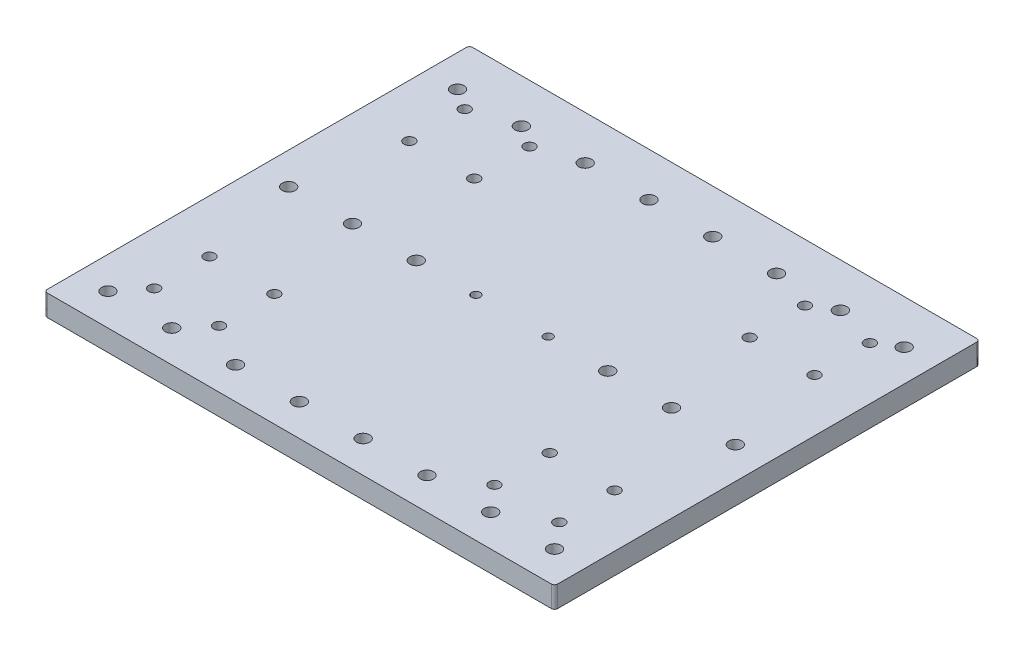
from build123d import *

# Parameters (mm, degrees)
SKETCH1_W           = 240
SKETCH1_H           = 200
BOSS_EXTRUDE1_DEPTH = 5
SKETCH2_R           = 2.55
CUT_EXTRUDE1_DEPTH  = 157.524758425
SKETCH3_R           = 2.05
CUT_EXTRUDE2_DEPTH  = 157.524758425
SKETCH4_R           = 3.05
CUT_EXTRUDE3_DEPTH  = 157.524758425
FILLET1_R           = 1.5


with BuildPart() as part:
    # Sketch1 → Boss-Extrude1 (new, symmetric)
    with BuildSketch(Plane(origin=(0, 0, 0), x_dir=(1, 0, 0), z_dir=(0, 1, 0))):
        Rectangle(SKETCH1_W, SKETCH1_H)
    extrude(amount=BOSS_EXTRUDE1_DEPTH, both=True)

    # Sketch2 → Cut-Extrude1 (cut, through all)
    with BuildSketch(Plane(origin=(0, 5, 0), x_dir=(1, 0, 0), z_dir=(0, 1, 0))):
        with Locations((-95.25, 73)):
            Circle(SKETCH2_R)
        with Locations((-95.25, 47)):
            Circle(SKETCH2_R)
        with Locations((-64.75, 73)):
            Circle(SKETCH2_R)
        with Locations((-64.75, 47)):
            Circle(SKETCH2_R)
        with Locations((-95.25, -47)):
            Circle(SKETCH2_R)
        with Locations((-95.25, -73)):
            Circle(SKETCH2_R)
        with Locations((-64.75, -73)):
            Circle(SKETCH2_R)
        with Locations((-64.75, -47)):
            Circle(SKETCH2_R)
        with Locations((95.25, -47)):
            Circle(SKETCH2_R)
        with Locations((64.75, -47)):
            Circle(SKETCH2_R)
        with Locations((64.75, -73)):
            Circle(SKETCH2_R)
        with Locations((95.25, -73)):
            Circle(SKETCH2_R)
        with Locations((64.75, 73)):
            Circle(SKETCH2_R)
        with Locations((64.75, 47)):
            Circle(SKETCH2_R)
        with Locations((95.25, 73)):
            Circle(SKETCH2_R)
        with Locations((95.25, 47)):
            Circle(SKETCH2_R)
    extrude(amount=-CUT_EXTRUDE1_DEPTH, mode=Mode.SUBTRACT)

    # Sketch3 → Cut-Extrude2 (cut, through all)
    with BuildSketch(Plane(origin=(0, 5, 0), x_dir=(1, 0, 0), z_dir=(0, 1, 0))):
        with Locations((-17, 0)):
            Circle(SKETCH3_R)
        with Locations((17, 0)):
            Circle(SKETCH3_R)
    extrude(amount=-CUT_EXTRUDE2_DEPTH, mode=Mode.SUBTRACT)

    # Sketch4 → Cut-Extrude3 (cut, through all)
    with BuildSketch(Plane(origin=(0, 5, 0), x_dir=(1, 0, 0), z_dir=(0, 1, 0))):
        with Locations((-105, 79.393522691)):
            Circle(SKETCH4_R)
        with Locations((-75, 79.393522691)):
            Circle(SKETCH4_R)
        with Locations((-45, 79.393522691)):
            Circle(SKETCH4_R)
        with Locations((-15, 79.393522691)):
            Circle(SKETCH4_R)
        with Locations((15, 79.393522691)):
            Circle(SKETCH4_R)
        with Locations((45, 79.393522691)):
            Circle(SKETCH4_R)
        with Locations((75, 79.393522691)):
            Circle(SKETCH4_R)
        with Locations((105, 79.393522691)):
            Circle(SKETCH4_R)
        with Locations((-105, 0)):
            Circle(SKETCH4_R)
        with Locations((-105, -85)):
            Circle(SKETCH4_R)
        with Locations((-75, 0)):
            Circle(SKETCH4_R)
        with Locations((-45, 0)):
            Circle(SKETCH4_R)
        with Locations((45, 0)):
            Circle(SKETCH4_R)
        with Locations((75, 0)):
            Circle(SKETCH4_R)
        with Locations((105, 0)):
            Circle(SKETCH4_R)
        with Locations((-75, -85)):
            Circle(SKETCH4_R)
        with Locations((-45, -85)):
            Circle(SKETCH4_R)
        with Locations((-15, -85)):
            Circle(SKETCH4_R)
        with Locations((15, -85)):
            Circle(SKETCH4_R)
        with Locations((45, -85)):
            Circle(SKETCH4_R)
        with Locations((75, -85)):
            Circle(SKETCH4_R)
        with Locations((105, -85)):
            Circle(SKETCH4_R)
    extrude(amount=-CUT_EXTRUDE3_DEPTH, mode=Mode.SUBTRACT)

    # Fillet1
    fillet1_edges = [part.edges().sort_by_distance(p)[0] for p in [
        (-120, 0, -100),
        (120, 0, -100),
        (-120, 0, 100),
        (120, 0, 100),
    ]]
    fillet(fillet1_edges, radius=FILLET1_R)


solid = part.part
